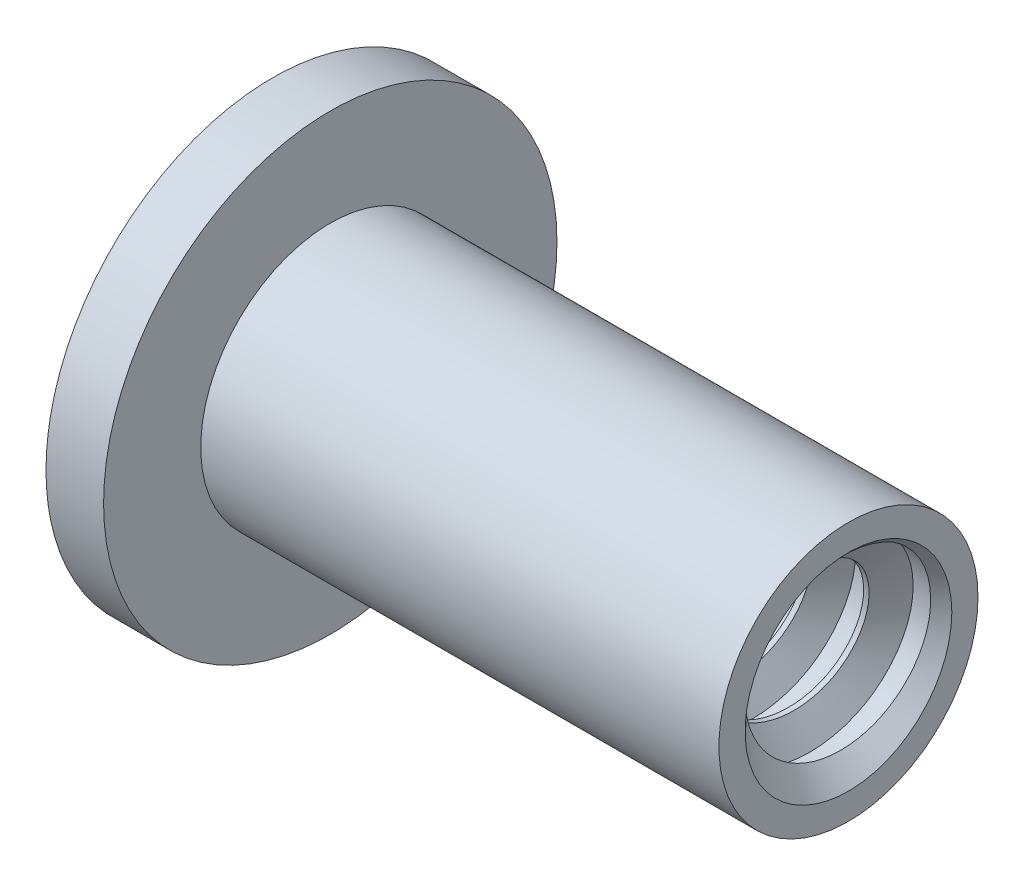
from build123d import *

# Parameters (mm, degrees)
SKETCH17_W                   = 11.1125
SKETCH17_H                   = 2.1717
CUT_EXTRUDE5_DEPTH           = 1.763889
SKETCH18_W                   = 2.1717
SKETCH18_H                   = 5.3086
CUT_EXTRUDE6_DEPTH           = 9.040044389
CUT_EXTRUDE6_OTHER_WAY_DEPTH = 1.058333
CUT_EXTRUDE6_OTHER_WAY_TAPER = 30
SKETCH19_W                   = 5.3086
SKETCH19_H                   = 2.1717
CUT_EXTRUDE7_DEPTH           = 1.058333
CUT_EXTRUDE7_DRAFT           = -30
SKETCH11_R                   = 3.175
SKETCH11_R_2                 = 2.413
BOSS_EXTRUDE3_DEPTH          = 12.7
BOSS_EXTRUDE4_START          = -9.525
SKETCH21_R                   = 2.413
BOSS_EXTRUDE4_DEPTH          = 9.525
CUT_SWEEP1_PITCH             = 1.411111111
SKETCH22_R                   = 2.413
BOSS_EXTRUDE6_DEPTH          = 9.525


with BuildPart() as part:
    # Sketch6 → Revolve1 (revolve)
    with BuildSketch(Plane.XY):
        with BuildLine():
            Line((7.9375, 0), (7.9375, 5.55625))
            Line((7.9375, 5.55625), (9.348611111, 5.55625))
            ThreePointArc((9.348611111, 5.55625), (10.660944275, 2.91475634), (11.1125, 0))
            Line((11.1125, 0), (7.9375, 0))
        make_face()
    revolve(axis=Axis((7.9375, 0, 0), (1, 0, 0)))

    # Sketch17 → Cut-Extrude5 (cut)
    with BuildSketch(Plane(origin=(11.1125, 0, 0), x_dir=(0, 0, -1), z_dir=(1, 0, 0))):
        Rectangle(SKETCH17_W, SKETCH17_H)
    extrude(amount=-CUT_EXTRUDE5_DEPTH, mode=Mode.SUBTRACT)

    # Sketch18 → Cut-Extrude6 (cut)
    with BuildSketch(Plane(origin=(9.348611111, 0, 0), x_dir=(0, 0, -1), z_dir=(1, 0, 0))):
        Rectangle(SKETCH18_W, SKETCH18_H)
    extrude(amount=CUT_EXTRUDE6_DEPTH, mode=Mode.SUBTRACT)

    # Sketch18 → Cut-Extrude6 other way (cut)
    with BuildSketch(Plane(origin=(9.348611111, 0, 0), x_dir=(0, 0, -1), z_dir=(1, 0, 0))):
        Rectangle(SKETCH18_W, SKETCH18_H)
    extrude(amount=-CUT_EXTRUDE6_OTHER_WAY_DEPTH, taper=CUT_EXTRUDE6_OTHER_WAY_TAPER, mode=Mode.SUBTRACT)


with BuildPart() as cut_extrude7_tool:
    # Sketch19 → Cut-Extrude7 (with draft: the straight prism first)
    with BuildSketch(Plane(origin=(9.348611111, 0, 0), x_dir=(0, 0, -1), z_dir=(1, 0, 0))):
        Rectangle(SKETCH19_W, SKETCH19_H)
    extrude(amount=-CUT_EXTRUDE7_DEPTH)
    # Cut-Extrude7: the draft: its side faces are tilted about the plane it starts from
    cut_extrude7_sides = [cut_extrude7_tool.faces().sort_by_distance(p)[0] for p in [
        (8.819444611, 0, 2.6543),
        (8.819444611, -1.08585, 0),
        (8.819444611, 0, -2.6543),
        (8.819444611, 1.08585, 0),
    ]]
    draft(cut_extrude7_sides, Plane(origin=(9.348611111, 0, 0), x_dir=(0, 0, -1), z_dir=(1, 0, 0)), CUT_EXTRUDE7_DRAFT)


with BuildPart() as part_1:
    add(part.part)

    # Cut-Extrude7: cut by cut_extrude7_tool
    add(cut_extrude7_tool.part, mode=Mode.SUBTRACT)


with BuildPart() as body_2:
    # Mirror1: mirrored copy
    add(part_1.part.mirror(Plane(origin=(-5.55625, 0, 0), x_dir=(0, 0, 1), z_dir=(1, 0, 0))))

    # Sketch11 → Boss-Extrude3 (add)
    with BuildSketch(Plane(origin=(-6.35, 0, 0), x_dir=(0, 0, -1), z_dir=(1, 0, 0))):
        Circle(SKETCH11_R)
        Circle(SKETCH11_R_2, mode=Mode.SUBTRACT)
    extrude(amount=-BOSS_EXTRUDE3_DEPTH)

    # Sketch22 → Boss-Extrude6 (add)
    with BuildSketch(Plane(origin=(-6.35, 0, 0), x_dir=(0, 0, -1), z_dir=(1, 0, 0))):
        Circle(SKETCH22_R)
    extrude(amount=-BOSS_EXTRUDE6_DEPTH)


with BuildPart() as body_2_2:
    # Sketch21 → Boss-Extrude4 (new body)
    with BuildSketch(Plane(origin=(-6.35, 0, 0), x_dir=(0, 0, -1), z_dir=(1, 0, 0)).offset(BOSS_EXTRUDE4_START)):
        Circle(SKETCH21_R)
    extrude(amount=BOSS_EXTRUDE4_DEPTH)

    # Cut-Sweep1: the profile of Sketch13 profile screwed along a right-hand helix of 7.75 turns, 8 arcs to a turn; built about Z, then put on its axis
    cut_sweep1_z = Axis((0, 0, 0), (0, 0, 1))
    cut_sweep1_corners = [(2.4133, 0, -0.926214872), (2.4133, 0, 0.000173205), (1.725592336, 0, -0.396875), (1.725592336, 0, -0.529166667)]
    with BuildLine(mode=Mode.PRIVATE) as cut_sweep1_profile:
        Line(cut_sweep1_corners[0], cut_sweep1_corners[1])
        Line(cut_sweep1_corners[1], cut_sweep1_corners[2])
        Line(cut_sweep1_corners[2], cut_sweep1_corners[3])
        Line(cut_sweep1_corners[3], cut_sweep1_corners[0])
    cut_sweep1_cap = Face(cut_sweep1_profile.wire())
    cut_sweep1_turn_angles = [0, 22.5, 45, 67.5, 90, 112.5, 135, 157.5, 180, 202.5, 225, 247.5, 270, 292.5, 315, 337.5, 360]
    cut_sweep1_turn_weights = [1, 0.9238795325112867, 1, 0.9238795325112867, 1, 0.9238795325112867, 1, 0.9238795325112867, 1, 0.9238795325112867, 1, 0.9238795325112867, 1, 0.9238795325112867, 1, 0.9238795325112867, 1]
    cut_sweep1_turn_rails = [Edge.make_bspline([Vector(p[0], p[1], 0).rotate(cut_sweep1_z, cut_sweep1_turn_angles[k]) / cut_sweep1_turn_weights[k] + Vector(0, 0, p[2] + CUT_SWEEP1_PITCH * cut_sweep1_turn_angles[k] / 360) for k in range(17)], [0, 0, 0, 1, 1, 2, 2, 3, 3, 4, 4, 5, 5, 6, 6, 7, 7, 8, 8, 8], 2, cut_sweep1_turn_weights) for p in cut_sweep1_corners]
    cut_sweep1_turn_sides = [Face.make_surface_from_curves(cut_sweep1_turn_rails[p[0]], cut_sweep1_turn_rails[p[1]]) for p in [(0, 1), (1, 2), (2, 3), (3, 0)]]
    cut_sweep1_last_angles = [2520, 2542.5, 2565, 2587.5, 2610, 2632.5, 2655, 2677.5, 2700, 2722.5, 2745, 2767.5, 2790]
    cut_sweep1_last_weights = [1, 0.9238795325112867, 1, 0.9238795325112867, 1, 0.9238795325112867, 1, 0.9238795325112867, 1, 0.9238795325112867, 1, 0.9238795325112715, 1]
    cut_sweep1_last_rails = [Edge.make_bspline([Vector(p[0], p[1], 0).rotate(cut_sweep1_z, cut_sweep1_last_angles[k]) / cut_sweep1_last_weights[k] + Vector(0, 0, p[2] + CUT_SWEEP1_PITCH * cut_sweep1_last_angles[k] / 360) for k in range(13)], [0, 0, 0, 1, 1, 2, 2, 3, 3, 4, 4, 5, 5, 6, 6, 6], 2, cut_sweep1_last_weights) for p in cut_sweep1_corners]
    cut_sweep1_last_sides = [Face.make_surface_from_curves(cut_sweep1_last_rails[p[0]], cut_sweep1_last_rails[p[1]]) for p in [(0, 1), (1, 2), (2, 3), (3, 0)]]
    cut_sweep1 = Plane(origin=(-6.35, 0, 0), x_dir=(0, 1, 0), z_dir=(-1, 0, 0)) * Solid(Shell([*[p.moved(Location((0, 0, CUT_SWEEP1_PITCH * i))) for i in range(7) for p in cut_sweep1_turn_sides], *cut_sweep1_last_sides, cut_sweep1_cap, cut_sweep1_cap.rotate(cut_sweep1_z, 2790).moved(Location((0, 0, CUT_SWEEP1_PITCH * 2790 / 360)))]))
    add(cut_sweep1, mode=Mode.SUBTRACT)

    # Boss-Extrude5 cone 1 section (through the dimple's axis) → Boss-Extrude5 (revolve)
    with BuildSketch(Plane(origin=(-6.35, 0, 0), x_dir=(0, 0, -1), z_dir=(0, 1, 0))):
        Polygon((0, 0), (2.53365, 0), (0, 2.53365), align=None)
    revolve(axis=Axis((-6.35, 0, 0), (-1, 0, 0)))


with BuildPart() as body_2_1:
    add(body_2.part)

    # Combine1: cut body 2 2
    add(body_2_2.part, mode=Mode.SUBTRACT)


solid = body_2_1.part
